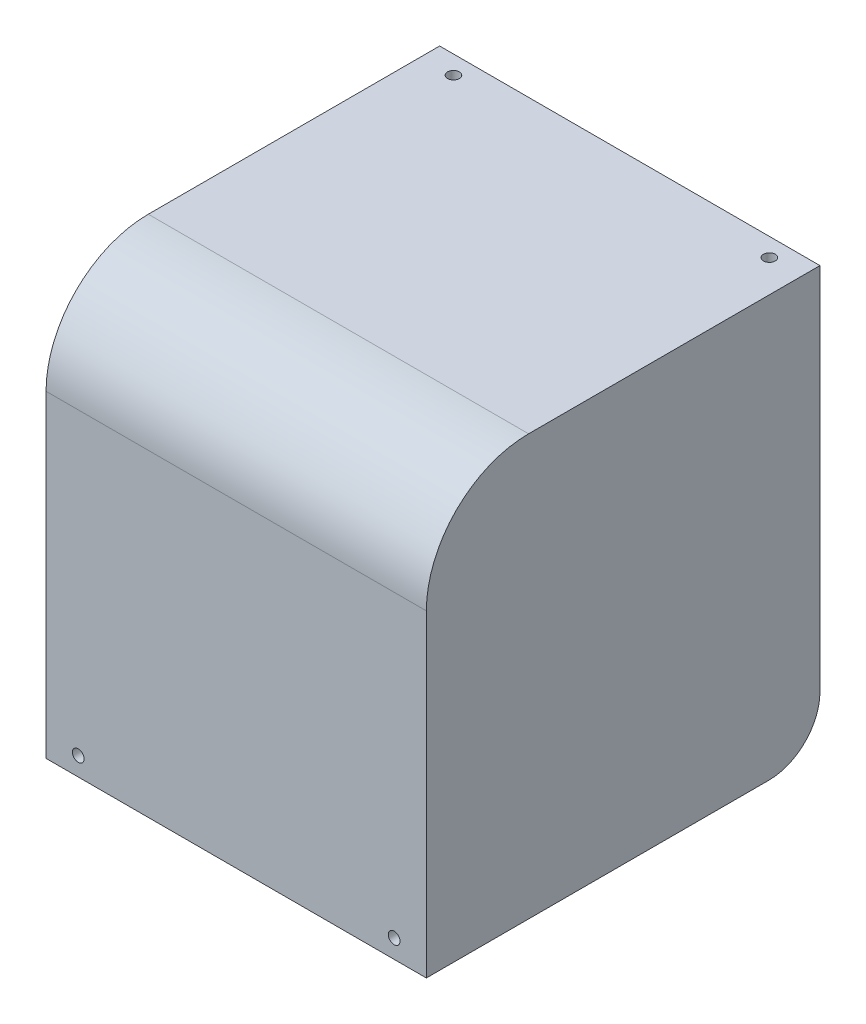
from build123d import *

# Parameters (mm, degrees)
BOSS_EXTRUDE1_DEPTH = 37.2
SKETCH2_R           = 1.15
CUT_EXTRUDE1_DEPTH  = 70
FILLET1_R           = 20
BOSS_EXTRUDE2_START = -2
BOSS_EXTRUDE2_DEPTH = 2
FILLET2_R           = 10
SKETCH4_R           = 1.15
CUT_EXTRUDE2_DEPTH  = 10


with BuildPart() as part:
    # Sketch1 → Boss-Extrude1 (new, symmetric)
    with BuildSketch(Plane(origin=(0, 0, 0), x_dir=(0, 0, -1), z_dir=(1, 0, 0))):
        Polygon((0, 0), (0, 82.2), (77, 82.2), (77, 80.2), (2, 80.2), (2, 0), align=None)
    extrude(amount=BOSS_EXTRUDE1_DEPTH, both=True)

    # Sketch2 → Cut-Extrude1 (cut)
    with BuildSketch(Plane.XY):
        with Locations((-30.9, 3.64)):
            Circle(SKETCH2_R)
        with Locations((30.9, 3.64)):
            Circle(SKETCH2_R)
    extrude(amount=-CUT_EXTRUDE1_DEPTH, mode=Mode.SUBTRACT)

    # Fillet1
    fillet1_edges = [part.edges().sort_by_distance(p)[0] for p in [
        (0, 82.2, 0),
        (0, 80.2, -2),
    ]]
    fillet(fillet1_edges, radius=FILLET1_R)

    # Sketch3 → Boss-Extrude2 (add)
    with BuildSketch(Plane.ZY.offset(37.2).offset(BOSS_EXTRUDE2_START)):
        with BuildLine():
            Line((-77, 80.2), (-77, 0))
            Line((-77, 0), (-2, 0))
            Line((-2, 0), (-2, 60.2))
            ThreePointArc((-2, 60.2), (-7.857864376, 74.342135624), (-22, 80.2))
            Line((-22, 80.2), (-77, 80.2))
        make_face()
    boss_extrude2 = extrude(amount=BOSS_EXTRUDE2_DEPTH)

    # Mirror1: Boss-Extrude2 across plane
    add(boss_extrude2.mirror(Plane(origin=(0, 0, 0), x_dir=(0, 0, 1), z_dir=(1, 0, 0))))

    # Fillet2
    fillet2_edges = [part.edges().sort_by_distance(p)[0] for p in [
        (-36.2, 0, -77),
        (36.2, 0, -77),
    ]]
    fillet(fillet2_edges, radius=FILLET2_R)

    # Sketch4 → Cut-Extrude2 (cut)
    with BuildSketch(Plane(origin=(0, 82.2, 0), x_dir=(1, 0, 0), z_dir=(0, 1, 0))):
        with Locations((-30.9, 73.401968)):
            Circle(SKETCH4_R)
        with Locations((30.9, 73.401968)):
            Circle(SKETCH4_R)
    extrude(amount=-CUT_EXTRUDE2_DEPTH, mode=Mode.SUBTRACT)


solid = part.part
